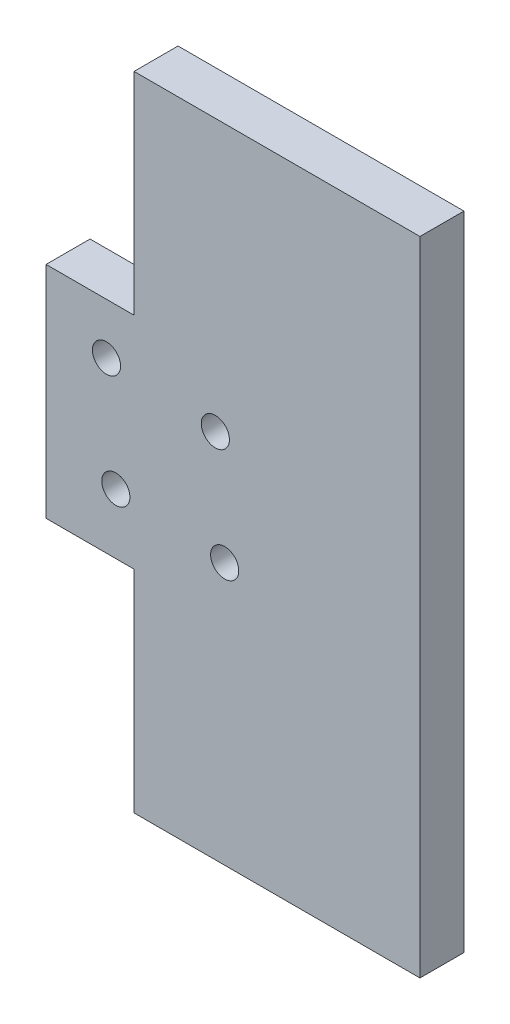
from build123d import *

# Parameters (mm, degrees)
SKETCH1_W           = 32.5
SKETCH1_H           = 73
BOSS_EXTRUDE1_DEPTH = 5
SKETCH4_W           = 5
SKETCH4_H           = 25
BOSS_EXTRUDE3_DEPTH = 10
SKETCH5_R           = 1.6
CUT_EXTRUDE1_DEPTH  = 25


with BuildPart() as part:
    # Sketch1 → Boss-Extrude1 (new body)
    with BuildSketch(Plane.XY):
        Rectangle(SKETCH1_W, SKETCH1_H)
    extrude(amount=BOSS_EXTRUDE1_DEPTH)

    # Sketch4 → Boss-Extrude3 (add)
    with BuildSketch(Plane.ZY.offset(16.25)):
        with Locations((2.5, 0)):
            Rectangle(SKETCH4_W, SKETCH4_H)
    extrude(amount=BOSS_EXTRUDE3_DEPTH)

    # Sketch5 → Cut-Extrude1 (cut)
    with BuildSketch(Plane.XY.offset(5)):
        with Locations((-19.381591891, 6.717514421)):
            Circle(SKETCH5_R)
        with Locations((-7.007223221, 5.656854249)):
            Circle(SKETCH5_R)
        with Locations((-18.320931719, -5.656854249)):
            Circle(SKETCH5_R)
        with Locations((-5.946563049, -6.717514421)):
            Circle(SKETCH5_R)
    extrude(amount=-CUT_EXTRUDE1_DEPTH, mode=Mode.SUBTRACT)


solid = part.part
